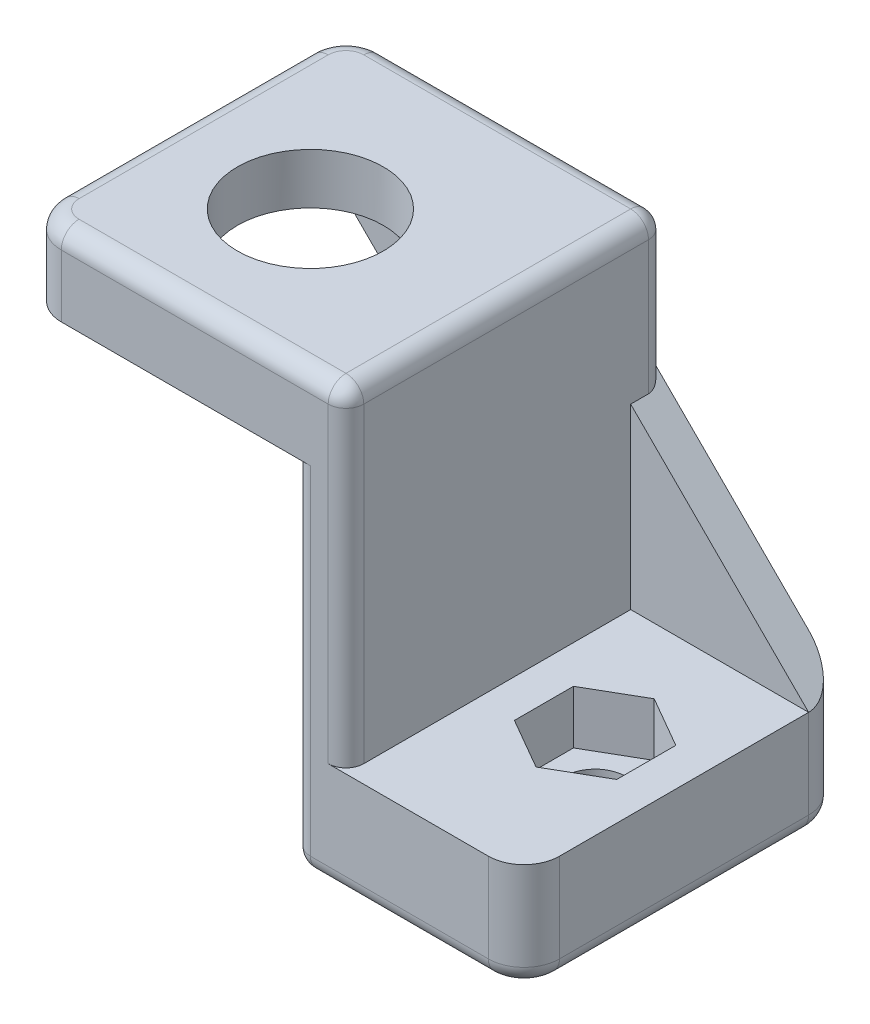
from build123d import *

# Parameters (mm, degrees)
BOSS_EXTRUDE1_DEPTH = 36
SKETCH3_R           = 3.5
CUT_EXTRUDE1_DEPTH  = 32
SKETCH2_R           = 8.2
CUT_EXTRUDE2_DEPTH  = 32
CUT_EXTRUDE3_DEPTH  = 6
BOSS_EXTRUDE3_DEPTH = 4
CUT_EXTRUDE4_DEPTH  = 3.3
FILLET1_R           = 4
FILLET4_R           = 2


with BuildPart() as part:
    # Sketch1 → Boss-Extrude1 (new body)
    with BuildSketch(Plane.XY):
        Polygon((0, 0), (0, 40), (-30, 40), (-30, 49), (6, 49), (6, 12), (26, 12), (26, 0), align=None)
    extrude(amount=BOSS_EXTRUDE1_DEPTH)

    # Sketch3 → Cut-Extrude1 (cut)
    with BuildSketch(Plane(origin=(0, 12, 0), x_dir=(1, 0, 0), z_dir=(0, 1, 0))):
        with Locations((16, -18)):
            Circle(SKETCH3_R)
    extrude(amount=-CUT_EXTRUDE1_DEPTH, mode=Mode.SUBTRACT)

    # Sketch2 → Cut-Extrude2 (cut)
    with BuildSketch(Plane(origin=(0, 49, 0), x_dir=(1, 0, 0), z_dir=(0, 1, 0))):
        with Locations((-14, -20)):
            Circle(SKETCH2_R)
    extrude(amount=-CUT_EXTRUDE2_DEPTH, mode=Mode.SUBTRACT)

    # Sketch4 → Cut-Extrude3 (cut)
    with BuildSketch(Plane(origin=(0, 12, 0), x_dir=(1, 0, 0), z_dir=(0, 1, 0))):
        Polygon((16, -24.639528096), (21.75, -21.319764048), (21.75, -14.680235952), (16, -11.360471904), (10.25, -14.680235952), (10.25, -21.319764048), align=None)
    extrude(amount=-CUT_EXTRUDE3_DEPTH, mode=Mode.SUBTRACT)

    # Sketch5 → Boss-Extrude3 (add)
    with BuildSketch(Plane(origin=(0, 0, 0), x_dir=(-1, 0, 0), z_dir=(0, 0, -1))):
        Polygon((-26, 12), (-6, 32), (-6, 12), align=None)
        Polygon((0, 10), (0, 40), (30, 40), align=None)
    extrude(amount=-BOSS_EXTRUDE3_DEPTH)

    # Sketch6 → Cut-Extrude4 (cut)
    with BuildSketch(Plane.XZ.offset(-40)):
        Polygon((-14, 4.988893001), (-1, 12.494446501), (-1, 27.505553499), (-14, 35.011106999), (-27, 27.505553499), (-27, 12.494446501), align=None)
    extrude(amount=-CUT_EXTRUDE4_DEPTH, mode=Mode.SUBTRACT)

    # Fillet1
    fillet1_edges = [part.edges().sort_by_distance(p)[0] for p in [
        (26, 6, 36),
        (26, 6, 0),
        (-30, 44.5, 36),
        (-30, 44.5, 0),
    ]]
    fillet(fillet1_edges, radius=FILLET1_R)

    # Fillet4
    fillet4_edges = [part.edges().sort_by_distance(p)[0] for p in [
        (11, 0, 36),
        (24.828427125, 0, 34.828427125),
        (11, 0, 0),
        (24.828427125, 0, 1.171572875),
        (-10, 49, 0),
        (-28.828427125, 49, 1.171572875),
        (-30, 49, 18),
        (-28.828427125, 49, 34.828427125),
        (6, 40.5, 0),
        (0, 20, 36),
        (26, 0, 18),
        (0, 0, 18),
        (-10, 49, 36),
        (6, 30.5, 36),
        (6, 49, 18),
    ]]
    fillet(fillet4_edges, radius=FILLET4_R)


solid = part.part
